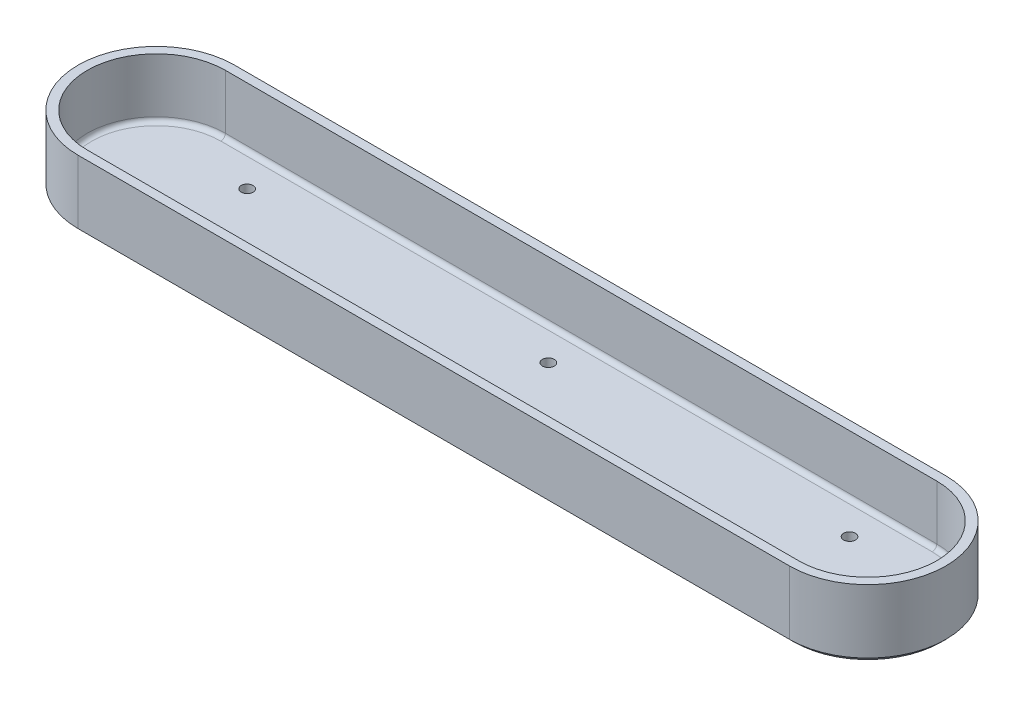
from build123d import *

# Parameters (mm, degrees)
MAINBLOCK_DEPTH     = 2.54
BOSS_EXTRUDE1_DEPTH = 19.05
SKETCH3_R           = 1.651
MOUNT_HOLES_DEPTH   = 125.700096476
FILLET1_R           = 1.27
CHAMFER1_SIZE       = 1.27


with BuildPart() as part:
    # Sketch1 → MainBlock (new body)
    with BuildSketch(Plane(origin=(0, 0, 0), x_dir=(1, 0, 0), z_dir=(0, 1, 0))):
        with BuildLine():
            Line((-99.441, 19.304), (99.441, 19.304))
            ThreePointArc((99.441, 19.304), (118.745, 0), (99.441, -19.304))
            Line((99.441, -19.304), (-99.441, -19.304))
            ThreePointArc((-99.441, -19.304), (-118.745, 0), (-99.441, 19.304))
        make_face()
    extrude(amount=MAINBLOCK_DEPTH)

    # Sketch2 → Boss-Extrude1 (add)
    with BuildSketch(Plane.XZ):
        with BuildLine():
            Line((-99.441, 21.844), (99.441, 21.844))
            ThreePointArc((99.441, 21.844), (121.285, 0), (99.441, -21.844))
            Line((99.441, -21.844), (-99.441, -21.844))
            ThreePointArc((-99.441, -21.844), (-121.285, 0), (-99.441, 21.844))
        make_face()
        with BuildLine():
            Line((99.441, 19.304), (-99.441, 19.304))
            ThreePointArc((-99.441, 19.304), (-118.745, 0), (-99.441, -19.304))
            Line((-99.441, -19.304), (99.441, -19.304))
            ThreePointArc((99.441, -19.304), (118.745, 0), (99.441, 19.304))
        make_face(mode=Mode.SUBTRACT)
    extrude(amount=-BOSS_EXTRUDE1_DEPTH)

    # Sketch3 → Mount-Holes (cut, through all)
    with BuildSketch(Plane.XZ):
        with Locations((0, 10.16)):
            Circle(SKETCH3_R)
        with Locations((-84.201, 10.16)):
            Circle(SKETCH3_R)
        with Locations((84.201, 10.16)):
            Circle(SKETCH3_R)
        with Locations((84.201, -10.16)):
            Circle(SKETCH3_R)
        with Locations((-84.201, -10.16)):
            Circle(SKETCH3_R)
        with Locations((0, -10.16)):
            Circle(SKETCH3_R)
    extrude(amount=-MOUNT_HOLES_DEPTH, mode=Mode.SUBTRACT)

    # Fillet1
    fillet1_edges = [part.edges().sort_by_distance(p)[0] for p in [
        (118.745, 2.54, 0),
        (0, 2.54, 19.304),
        (-118.745, 2.54, 0),
        (0, 2.54, -19.304),
    ]]
    fillet(fillet1_edges, radius=FILLET1_R)

    # Chamfer1
    chamfer1_edges = [part.edges().sort_by_distance(p)[0] for p in [
        (0, 0, 21.844),
        (-121.285, 0, 0),
        (121.285, 0, 0),
        (0, 0, -21.844),
    ]]
    chamfer(chamfer1_edges, length=CHAMFER1_SIZE)


solid = part.part
